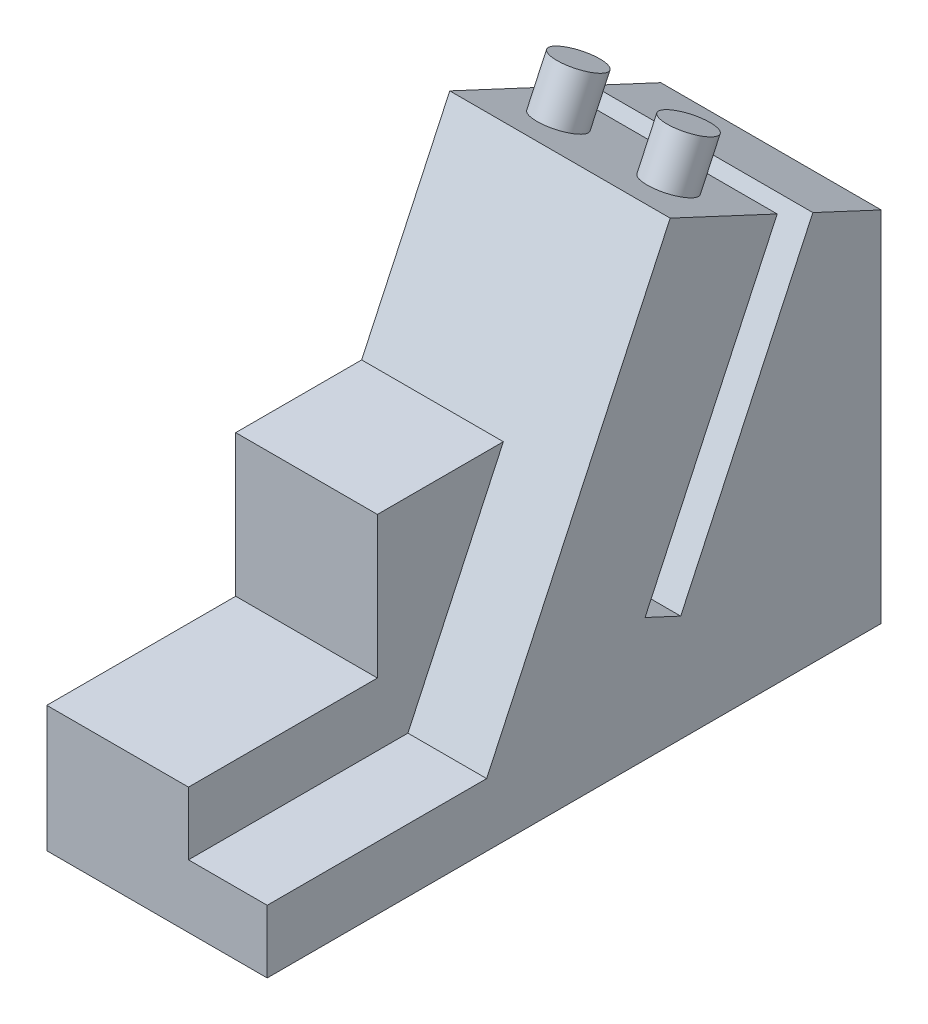
from build123d import *

# Parameters (mm, degrees)
SKETCH1_W           = 28
SKETCH1_H           = 78
BOSS_EXTRUDE1_DEPTH = 58
SKETCH2_OUTSIDE_W   = 100.23
SKETCH2_OUTSIDE_H   = 80.23
CUT_EXTRUDE1_DEPTH  = 102.153348931
CUT_EXTRUDE2_DEPTH  = 10
SKETCH3_R           = 3
BOSS_EXTRUDE2_DEPTH = 6


with BuildPart() as part:
    # Sketch1 → Boss-Extrude1 (new body)
    with BuildSketch(Plane(origin=(0, 0, 0), x_dir=(1, 0, 0), z_dir=(0, 1, 0))):
        with Locations((14, 39)):
            Rectangle(SKETCH1_W, SKETCH1_H)
    extrude(amount=BOSS_EXTRUDE1_DEPTH)

    # Sketch2 outside → Cut-Extrude1 (cut, through all)
    with BuildSketch(Plane(origin=(28, 0, 0), x_dir=(0, 0, -1), z_dir=(1, 0, 0))):
        with Locations((39, 29)):
            Rectangle(SKETCH2_OUTSIDE_W, SKETCH2_OUTSIDE_H)
        Polygon((0, 0), (78, 0), (78, 45.498936959), (69.317539536, 49.547634765), (52.530463843, 13.547634765), (47.998924908, 15.660726074), (64.786000601, 51.660726074), (51.191383796, 58), (40, 34), (24, 34), (24, 16), (0, 16), align=None, mode=Mode.SUBTRACT)
    extrude(amount=-CUT_EXTRUDE1_DEPTH, mode=Mode.SUBTRACT)

    # Sketch2<3> → Cut-Extrude2 (cut)
    with BuildSketch(Plane(origin=(28, 0, 0), x_dir=(0, 0, -1), z_dir=(1, 0, 0))):
        Polygon((0, 16), (0, 8), (27.876000888, 8), (40, 34), (24, 34), (24, 16), align=None)
    extrude(amount=-CUT_EXTRUDE2_DEPTH, mode=Mode.SUBTRACT)

    # Sketch3 → Boss-Extrude2 (add)
    with BuildSketch(Plane(origin=(0, 67.248278227, -31.358387135), x_dir=(1, 0, 0), z_dir=(0, 0.906307787036651, -0.4226182617406971))):
        with Locations((7, 29.383290582)):
            Circle(SKETCH3_R)
        with Locations((21, 29.383290582)):
            Circle(SKETCH3_R)
    extrude(amount=BOSS_EXTRUDE2_DEPTH)


solid = part.part
